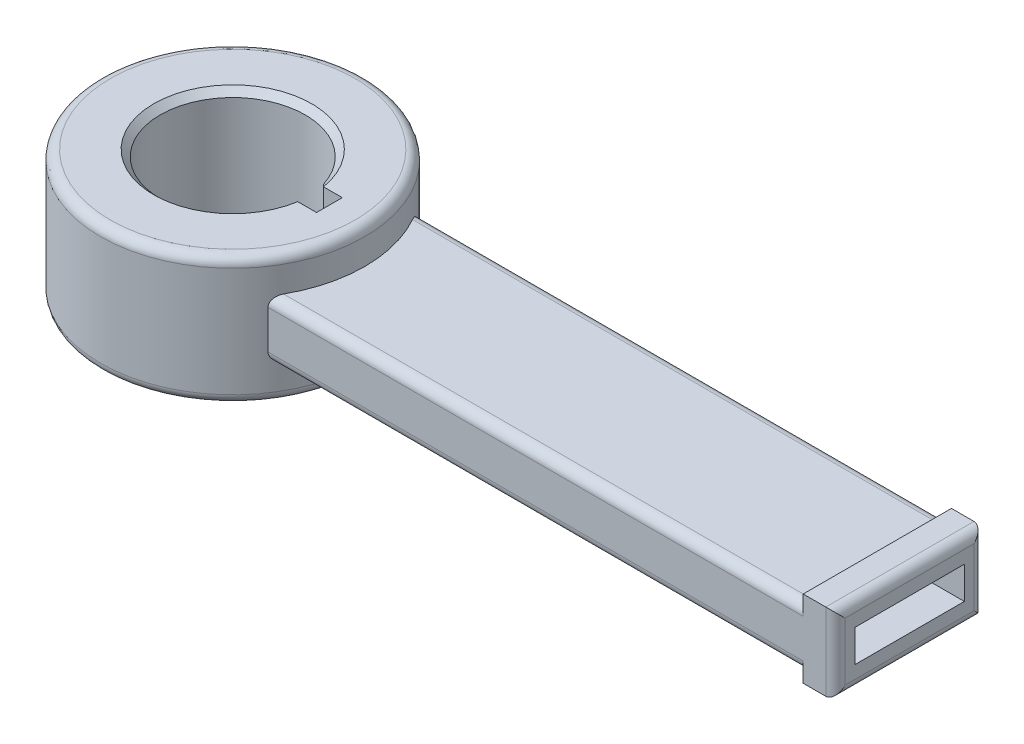
from build123d import *

# Parameters (mm, degrees)
SKETCH_1_R           = 41
SKETCH_1_R_2         = 22.5
EXTRUDE_1_DEPTH      = 40
SKETCH_2_W           = 46
SKETCH_2_H           = 24
EXTRUDE_2_DEPTH      = 10
EXTRUDE_3_REACH      = 249.714
EXTRUDE_3_END_RADIUS = 41
SKETCH_3_W           = 46
SKETCH_3_H           = 18
SKETCH_4_W           = 40.100646326
SKETCH_4_H           = 8
CUT_EXTRUDE_1_DEPTH  = 218.671771252
SKETCH_5_W           = 34
SKETCH_5_H           = 10
CUT_EXTRUDE_2_DEPTH  = 10
FILLET_1_R           = 3
CHAMFER_1_SIZE       = 2


with BuildPart() as part:
    # 草图1 → 凸台-拉伸1 (new body)
    with BuildSketch(Plane(origin=(0, 0, 0), x_dir=(1, 0, 0), z_dir=(0, 1, 0))):
        with Locations(Location((0, 0, 0), (0, 0, 270))):
            Circle(SKETCH_1_R)
        with Locations(Location((0, 0, 0), (0, 0, 270))):
            Circle(SKETCH_1_R_2, mode=Mode.SUBTRACT)
    extrude(amount=EXTRUDE_1_DEPTH)



with BuildPart() as body_2:
    # 草图2 → 凸台-拉伸2 (new body)
    with BuildSketch(Plane(origin=(200, 0, 0), x_dir=(0, 0, -1), z_dir=(1, 0, 0))):
        with Locations((0, 20)):
            Rectangle(SKETCH_2_W, SKETCH_2_H)
    extrude(amount=EXTRUDE_2_DEPTH)


with BuildPart() as part_1:
    add(part.part)

    add(body_2.part)  # 凸台-拉伸3 merges body 2
    # 凸台-拉伸3: up to this cylinder (the profile starts outside it)
    extrude_3_end = Plane(origin=(0, 20, 0), z_dir=(0, -1, 0)) * Cylinder(EXTRUDE_3_END_RADIUS, 582.428, mode=Mode.PRIVATE)
    # 草图3 → 凸台-拉伸3 (add, up to the surface)
    with BuildSketch(Plane(origin=(200, 0, 0), x_dir=(0, 0, -1), z_dir=(1, 0, 0)), mode=Mode.PRIVATE) as extrude_3_sk1:
        with Locations((0, 20)):
            Rectangle(SKETCH_3_W, SKETCH_3_H)
    extrude_3_tool1 = extrude(extrude_3_sk1.sketch, amount=-EXTRUDE_3_REACH, mode=Mode.PRIVATE) - extrude_3_end
    add(extrude_3_tool1.solids().sort_by_distance((200, 20, 0))[0])

    # 草图4 → 切除-拉伸1 (cut, through all)
    with BuildSketch(Plane(origin=(0, 0, 0), x_dir=(1, 0, 0), z_dir=(0, 1, 0))):
        with Locations((9.949676837, 0)):
            Rectangle(SKETCH_4_W, SKETCH_4_H)
    extrude(amount=CUT_EXTRUDE_1_DEPTH, mode=Mode.SUBTRACT)

    # 草图5 → 切除-拉伸2 (cut, symmetric)
    with BuildSketch(Plane(origin=(200, 0, 0), x_dir=(0, 0, -1), z_dir=(1, 0, 0))):
        with Locations((0, 20)):
            Rectangle(SKETCH_5_W, SKETCH_5_H)
    extrude(amount=CUT_EXTRUDE_2_DEPTH, both=True, mode=Mode.SUBTRACT)

    # 圆角1
    fillet_1_edges = [part_1.edges().sort_by_distance(p)[0] for p in [
        (116.970562748, 29, 23),
        (116.970562748, 11, 23),
        (116.970562748, 11, -23),
        (116.970562748, 29, -23),
        (0, 0, -41),
        (210, 20, -23),
        (210, 32, 0),
        (210, 20, 23),
        (210, 8, 0),
        (0, 40, -41),
    ]]
    fillet(fillet_1_edges, radius=FILLET_1_R)

    # 倒角1
    # the kernel refuses this chamfer: 2.480488228, 2 mm, written as the material it takes off along each edge
    with BuildSketch(Plane(origin=(22.141589825, 47.02037687, 4), x_dir=(1, 0, 0), z_dir=(0, -1, 0))) as chamfer_1_piece_1:
        with BuildLine():
            Line((CHAMFER_1_SIZE, 0), (-0.645316442, 2.645316442))
            ThreePointArc((-0.645316442, 2.645316442), (-0.292721572, 1.373728317), (0, 0))
            Line((0, 0), (CHAMFER_1_SIZE, 0))
        make_face()
    extrude(amount=54.040753739, mode=Mode.SUBTRACT)
    with BuildSketch(Plane(origin=(22.141589825, 47.02037687, -4), x_dir=(1, 0, 0), z_dir=(0, -1, 0))) as chamfer_1_piece_2:
        with BuildLine():
            Line((CHAMFER_1_SIZE, 0), (-0.645316442, -2.645316442))
            ThreePointArc((-0.645316442, -2.645316442), (-0.292721572, -1.373728317), (0, 0))
            Line((0, 0), (CHAMFER_1_SIZE, 0))
        make_face()
    extrude(amount=54.040753739, mode=Mode.SUBTRACT)
    # the kernel refuses this chamfer: 2.480488228, 2 mm, written as the material it takes off along each edge
    with BuildSketch(Plane(origin=(0, 40, 0), x_dir=(0.9975496866331381, 0, 0.06996158015745366), z_dir=(0.06996158015745366, 0, -0.9975496866331381))) as chamfer_1_2_piece_1:
        Polygon((22.5 + CHAMFER_1_SIZE, 0), (22.5, CHAMFER_1_SIZE), (22.5, 0), align=None)
    revolve(axis=Axis((0, 40, 0), (0, -1, 0)), revolution_arc=351.976438974, mode=Mode.SUBTRACT)
    with BuildSketch(Plane(origin=(0, 0, 0), x_dir=(0.9975496866331381, 0, -0.06996158015745378), z_dir=(0.06996158015745378, 0, 0.9975496866331381))) as chamfer_1_2_piece_2:
        Polygon((22.5 + CHAMFER_1_SIZE, 0), (22.5, CHAMFER_1_SIZE), (22.5, 0), align=None)
    revolve(axis=Axis((0, 0, 0), (0, 1, 0)), revolution_arc=351.976438974, mode=Mode.SUBTRACT)


solid = part_1.part
